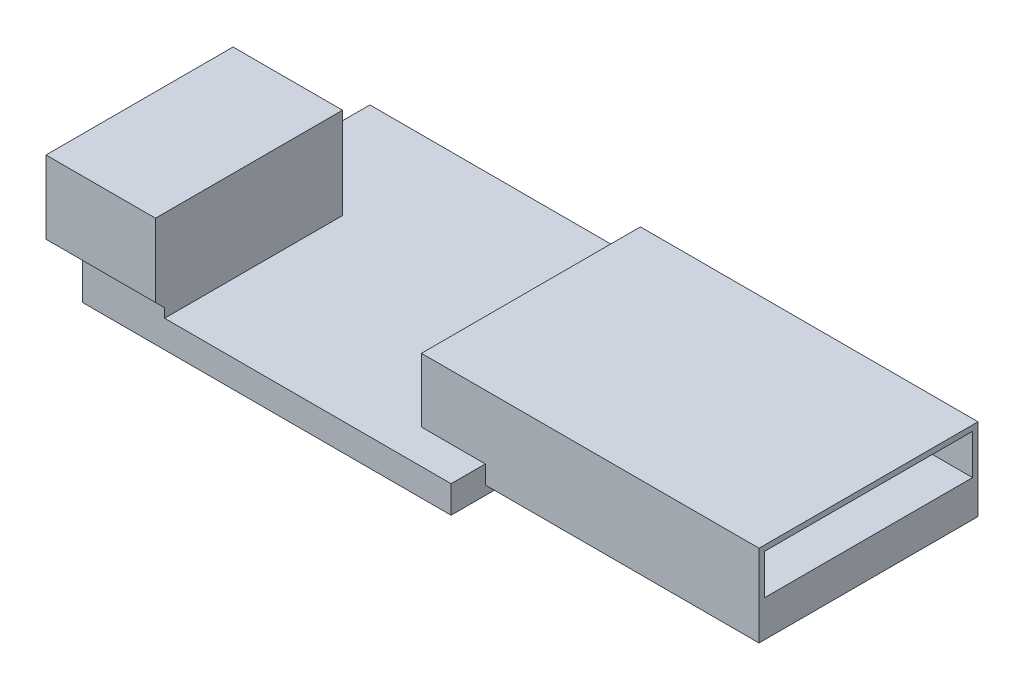
from build123d import *

# Parameters (mm, degrees)
ESQUISSE1_W             = 20.2
ESQUISSE1_H             = 15.75
BOSS_EXTRU_1_DEPTH      = 1.5
BOSS_EXTRU_2_DEPTH      = 3.5
BOSS_EXTRU_2_DEPTH_BACK = 1
ESQUISSE2_W             = 18.5
ESQUISSE2_H             = 12
ESQUISSE3_W             = 11.4
ESQUISSE3_H             = 2.2
ENL_V_MAT_EXTRU_1_DEPTH = 13.5
ESQUISSE4_W             = 6
ESQUISSE4_H             = 10.25
BOSS_EXTRU_4_DEPTH      = 5
CHANFREIN1_SIZE         = 1


with BuildPart() as part:
    # Esquisse1 → Boss.-Extru.1 (new body)
    with BuildSketch(Plane(origin=(0, 0, 0), x_dir=(1, 0, 0), z_dir=(0, 1, 0))):
        with Locations((-10.1, 7.875)):
            Rectangle(ESQUISSE1_W, ESQUISSE1_H)
    extrude(amount=BOSS_EXTRU_1_DEPTH)

    # Esquisse2 → Boss.-Extru.2 (add, two sides: drawn at the far end of the back side and taken through both)
    with BuildSketch(Plane(origin=(0, 1.5, 0), x_dir=(1, 0, 0), z_dir=(0, 1, 0)).offset(-BOSS_EXTRU_2_DEPTH_BACK)):
        with Locations((5.75, 7.875)):
            Rectangle(ESQUISSE2_W, ESQUISSE2_H)
    extrude(amount=BOSS_EXTRU_2_DEPTH + BOSS_EXTRU_2_DEPTH_BACK)

    # Esquisse3 → Enlèv. mat.-Extru.1 (cut)
    with BuildSketch(Plane(origin=(15, 0, 0), x_dir=(0, 0, -1), z_dir=(1, 0, 0))):
        with Locations((7.875, 3.6)):
            Rectangle(ESQUISSE3_W, ESQUISSE3_H)
    extrude(amount=-ENL_V_MAT_EXTRU_1_DEPTH, mode=Mode.SUBTRACT)

    # Esquisse4 → Boss.-Extru.4 (add)
    with BuildSketch(Plane(origin=(0, 1.5, 0), x_dir=(1, 0, 0), z_dir=(0, 1, 0))):
        with Locations((-18.7, 4.625)):
            Rectangle(ESQUISSE4_W, ESQUISSE4_H)
    extrude(amount=BOSS_EXTRU_4_DEPTH)

    # Chanfrein1
    # the kernel refuses this chamfer: 1 mm, written as the material it takes off along each edge
    with BuildSketch(Plane(origin=(-13.128317012, 1.5, 0.5), x_dir=(0, -0.02749587661058627, -0.9996219169112968), z_dir=(-1, 0, 0))) as chanfrein1_piece_1_section:
        Polygon((CHANFREIN1_SIZE * 0.999621916911, -CHANFREIN1_SIZE * 0.0274958766106), (-CHANFREIN1_SIZE * 0.0274958766106, -CHANFREIN1_SIZE * 0.999621916911), (0, 0), align=None)
    chanfrein1_piece_1 = extrude(amount=11.143365976, mode=Mode.PRIVATE)
    chanfrein1_piece_1 = split(chanfrein1_piece_1, bisect_by=Plane(origin=(-16.664158506, 1.893401084, 0), z_dir=(0, 0, 1)), keep=Keep.TOP, mode=Mode.PRIVATE)
    chanfrein1_piece_1 = split(chanfrein1_piece_1, bisect_by=Plane(origin=(-20.2, 1.893401084, 0.29176571), z_dir=(1, 0, 0)), keep=Keep.TOP, mode=Mode.PRIVATE)
    add(chanfrein1_piece_1, mode=Mode.SUBTRACT)
    with BuildSketch(Plane(origin=(-13.128317012, 1.5, 0.5), x_dir=(0, -0.02749587661058627, -0.9996219169112968), z_dir=(-1, 0, 0))) as chanfrein1_piece_2_section:
        Polygon((CHANFREIN1_SIZE * 0.999621916911, -CHANFREIN1_SIZE * 0.0274958766106), (-CHANFREIN1_SIZE * 0.0274958766106, -CHANFREIN1_SIZE * 0.999621916911), (0, 0), align=None)
    chanfrein1_piece_2 = extrude(amount=11.143365976, mode=Mode.PRIVATE)
    chanfrein1_piece_2 = split(chanfrein1_piece_2, bisect_by=Plane(origin=(-22.235841494, 1.645570657, 0), z_dir=(0, 0, -1)), keep=Keep.TOP, mode=Mode.PRIVATE)
    chanfrein1_piece_2 = split(chanfrein1_piece_2, bisect_by=Plane(origin=(-20.2, 1.645570657, -0.181859612), z_dir=(-1, 0, 0)), keep=Keep.TOP, mode=Mode.PRIVATE)
    add(chanfrein1_piece_2, mode=Mode.SUBTRACT)
    with BuildSketch(Plane(origin=(-13.128317012, 1.5, 0.5), x_dir=(0, -0.02749587661058627, -0.9996219169112968), z_dir=(-1, 0, 0))) as chanfrein1_piece_3_section:
        Polygon((CHANFREIN1_SIZE * 0.999621916911, -CHANFREIN1_SIZE * 0.0274958766106), (-CHANFREIN1_SIZE * 0.0274958766106, -CHANFREIN1_SIZE * 0.999621916911), (0, 0), align=None)
    chanfrein1_piece_3 = extrude(amount=11.143365976, mode=Mode.PRIVATE)
    chanfrein1_piece_3 = split(chanfrein1_piece_3, bisect_by=Plane(origin=(-22.235841494, 1.893401084, 0), z_dir=(0, 0, 1)), keep=Keep.TOP, mode=Mode.PRIVATE)
    chanfrein1_piece_3 = split(chanfrein1_piece_3, bisect_by=Plane(origin=(-20.2, 1.893401084, 0.29176571), z_dir=(-1, 0, 0)), keep=Keep.TOP, mode=Mode.PRIVATE)
    add(chanfrein1_piece_3, mode=Mode.SUBTRACT)


solid = part.part
